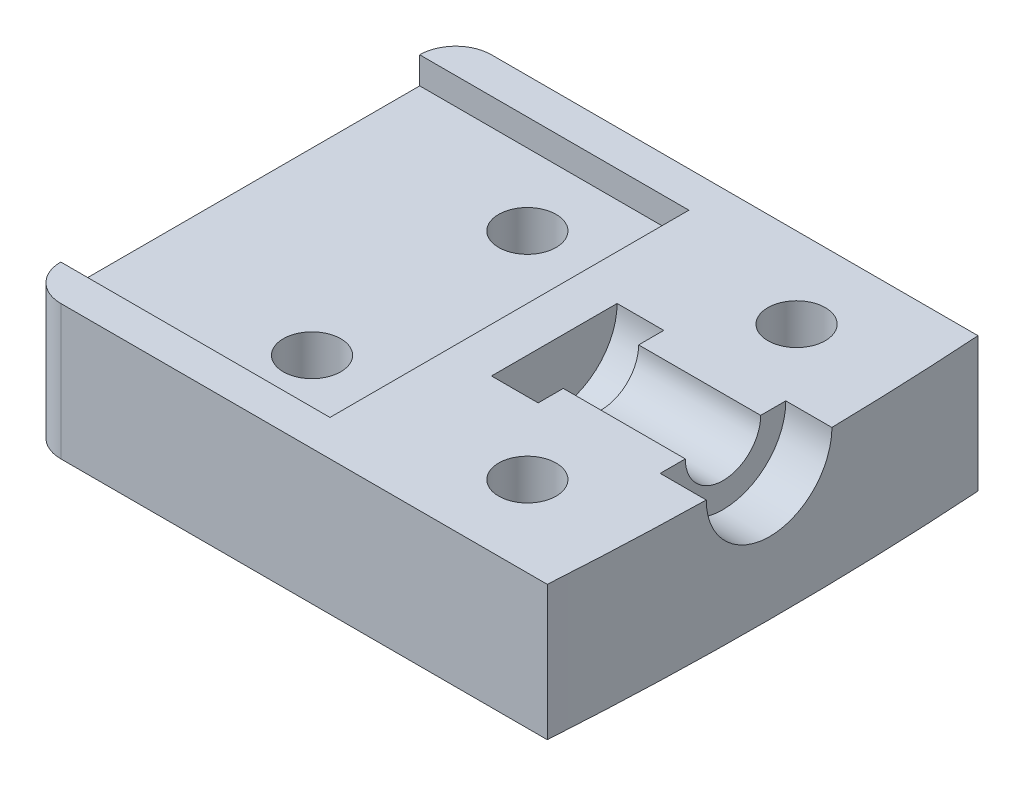
from build123d import *

# Parameters (mm, degrees)
BOSS_EXTRUDE1_DEPTH        = 10
SKETCH2_W                  = 15
SKETCH2_H                  = 20
CUT_EXTRUDE1_DEPTH         = 1.5
SKETCH4_R                  = 2.1
CUT_EXTRUDE2_DEPTH         = 24.457408211
FILLET1_R                  = 2
SKETCH5_R                  = 3.5
CUT_EXTRUDE3_DEPTH         = 2.6
SKETCH8_W                  = 2.6
SKETCH8_H                  = 3.5
F_3_2_3_2_DIAMETER_HOLE2_D = 3.2
F_3_2_3_2_DIAMETER_HOLE1_D = 3.2
CUT_EXTRUDE6_START         = -2.5
CUT_EXTRUDE6_DEPTH         = 2.5


with BuildPart() as part:
    # Sketch1 → Boss-Extrude1 (new body)
    with BuildSketch(Plane(origin=(0, 0, 0), x_dir=(1, 0, 0), z_dir=(0, 1, 0))):
        with BuildLine():
            Line((-25, -12), (4.109342511, -12))
            ThreePointArc((4.109342511, -12), (4.5, 0), (4.109342511, 12))
            Line((4.109342511, 12), (-25, 12))
            Line((-25, 12), (-25, -12))
        make_face()
    extrude(amount=BOSS_EXTRUDE1_DEPTH)

    # Sketch2 → Cut-Extrude1 (cut)
    with BuildSketch(Plane(origin=(0, 10, 0), x_dir=(1, 0, 0), z_dir=(0, 1, 0))):
        with Locations((-17.5, 0)):
            Rectangle(SKETCH2_W, SKETCH2_H)
    extrude(amount=-CUT_EXTRUDE1_DEPTH, mode=Mode.SUBTRACT)

    # Sketch4 → Cut-Extrude2 (cut, through all)
    with BuildSketch(Plane(origin=(-7.5, 0, 0), x_dir=(0, 0, -1), z_dir=(1, 0, 0))):
        with Locations((0, 10)):
            Circle(SKETCH4_R)
    extrude(amount=CUT_EXTRUDE2_DEPTH, mode=Mode.SUBTRACT)

    # Fillet1
    fillet1_edges = [part.edges().sort_by_distance(p)[0] for p in [
        (-25, 5, -12),
        (-25, 5, 12),
    ]]
    fillet(fillet1_edges, radius=FILLET1_R)

    # Sketch5 → Cut-Extrude3 (cut)
    with BuildSketch(Plane(origin=(-7.5, 0, 0), x_dir=(0, 0, -1), z_dir=(1, 0, 0))):
        with Locations((0, 10)):
            Circle(SKETCH5_R)
    extrude(amount=CUT_EXTRUDE3_DEPTH, mode=Mode.SUBTRACT)

    # Sketch8 → Cut-Revolve1 (revolve, cut)
    with BuildSketch(Plane(origin=(0, 10, 0), x_dir=(1, 0, 0), z_dir=(0, 1, 0))):
        with Locations((3.2, 1.75)):
            Rectangle(SKETCH8_W, SKETCH8_H)
    revolve(axis=Axis((0, 10, 0), (1, 0, 0)), mode=Mode.SUBTRACT)

    # Ø3.2 (3.2) Diameter Hole2 (through all)
    with Locations(Plane(origin=(0, 8.5, 0), x_dir=(1, 0, 0), z_dir=(0, 1, 0))):
        with Locations((-15, 6), (-15, -6)):
            Hole(F_3_2_3_2_DIAMETER_HOLE2_D / 2)

    # Ø3.2 (3.2) Diameter Hole1 (through all)
    with Locations(Plane(origin=(0, 10, 0), x_dir=(1, 0, 0), z_dir=(0, 1, 0))):
        with Locations((-1.5, 7.5), (-1.5, -7.5)):
            Hole(F_3_2_3_2_DIAMETER_HOLE1_D / 2)

    # Sketch17 → Cut-Extrude6 (cut)
    with BuildSketch(Plane.XZ.offset(CUT_EXTRUDE6_START)):
        with BuildLine():
            Line((-25, 10), (-25, -10))
            ThreePointArc((-25, -10), (-24.414213562, -11.414213562), (-23, -12))
            Line((-23, -12), (4.109342511, -12))
            ThreePointArc((4.109342511, -12), (4.5, 0), (4.109342511, 12))
            Line((4.109342511, 12), (-23, 12))
            ThreePointArc((-23, 12), (-24.414213562, 11.414213562), (-25, 10))
        make_face()
    extrude(amount=CUT_EXTRUDE6_DEPTH, mode=Mode.SUBTRACT)


solid = part.part
